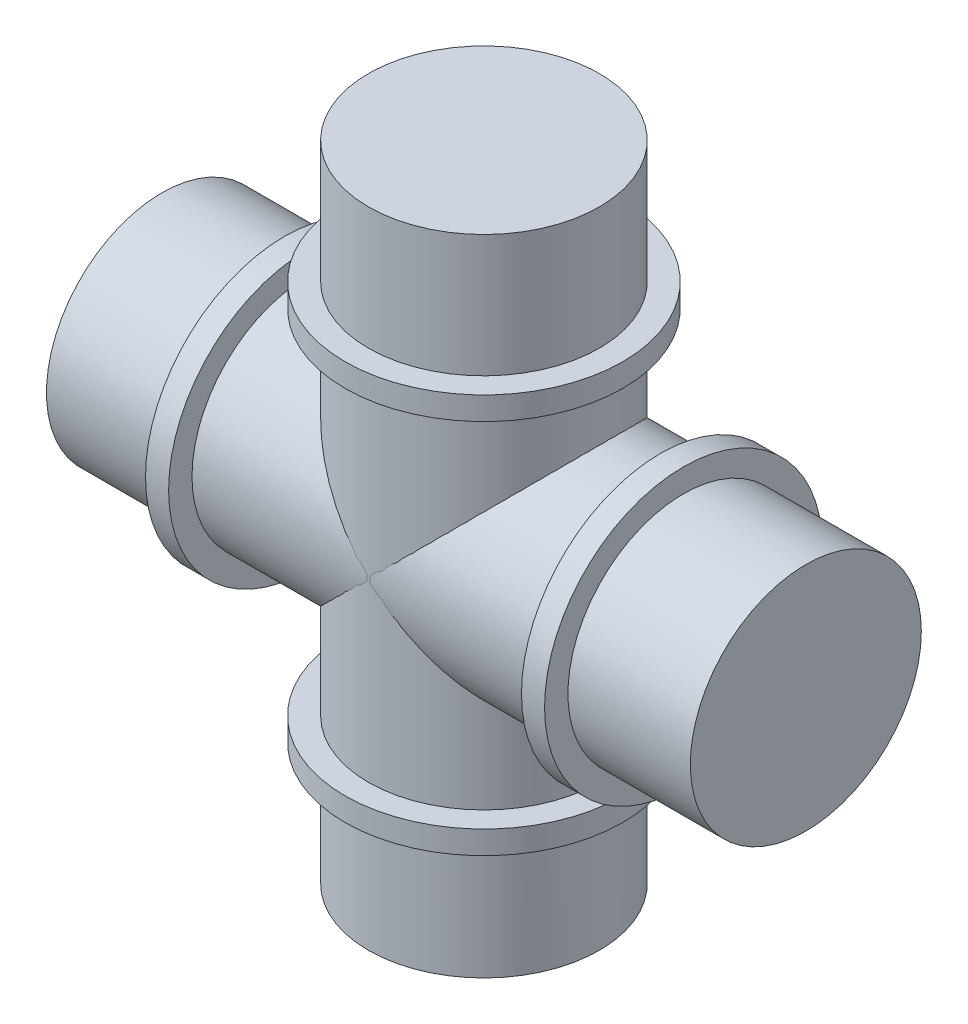
from build123d import *

# Parameters (mm, degrees)
BOSS_EXTRUDE1_DEPTH      = 304
BOSS_EXTRUDE1_DEPTH_BACK = 50
SKETCH1_R                = 63.5
BOSS_EXTRUDE2_DEPTH      = 177
BOSS_EXTRUDE2_DEPTH_BACK = 177
BOSS_EXTRUDE3_START      = -80
SKETCH5_R                = 76.35
SKETCH5_R_2              = 63.5
BOSS_EXTRUDE3_DEPTH      = 12.7
BOSS_EXTRUDE4_START      = -80
SKETCH6_R                = 76.35
BOSS_EXTRUDE4_DEPTH      = 12.7
BOSS_EXTRUDE5_START      = -80
SKETCH7_R                = 76.35
SKETCH7_R_2              = 63.5
BOSS_EXTRUDE5_DEPTH      = 12.7
BOSS_EXTRUDE6_START      = -67.3
SKETCH8_R                = 76.35
BOSS_EXTRUDE6_DEPTH      = 12.7


with BuildPart() as part:
    # Sketch1 → Boss-Extrude1 (new, two sides: drawn at the far end of the back side and taken through both)
    with BuildSketch(Plane(origin=(0, 0, 0), x_dir=(1, 0, 0), z_dir=(0, 1, 0)).offset(-BOSS_EXTRUDE1_DEPTH_BACK)):
        Circle(SKETCH1_R)
    extrude(amount=BOSS_EXTRUDE1_DEPTH + BOSS_EXTRUDE1_DEPTH_BACK)

    # Sketch6 → Boss-Extrude4 (add)
    with BuildSketch(Plane.XZ.offset(50).offset(BOSS_EXTRUDE4_START)):
        Circle(SKETCH6_R)
    extrude(amount=BOSS_EXTRUDE4_DEPTH)

    # Sketch8 → Boss-Extrude6 (add)
    with BuildSketch(Plane(origin=(0, 304, 0), x_dir=(1, 0, 0), z_dir=(0, 1, 0)).offset(BOSS_EXTRUDE6_START)):
        Circle(SKETCH8_R)
    extrude(amount=-BOSS_EXTRUDE6_DEPTH)


with BuildPart() as body_2:
    # Sketch3 → Boss-Extrude2 (new, two sides: drawn at the far end of the back side and taken through both)
    with BuildSketch(Plane(origin=(0, 0, 0), x_dir=(0, 0, -1), z_dir=(1, 0, 0)).offset(-BOSS_EXTRUDE2_DEPTH_BACK)):
        with BuildLine():
            ThreePointArc((0, 63.5), (44.901280605, 82.098719395), (63.5, 127))
            ThreePointArc((63.5, 127), (-44.901280605, 171.901280605), (0, 63.5))
        make_face()
    extrude(amount=BOSS_EXTRUDE2_DEPTH + BOSS_EXTRUDE2_DEPTH_BACK)

    # Sketch5 → Boss-Extrude3 (add)
    with BuildSketch(Plane(origin=(177, 0, 0), x_dir=(0, 0, -1), z_dir=(1, 0, 0)).offset(BOSS_EXTRUDE3_START)):
        with Locations((0, 127)):
            Circle(SKETCH5_R)
        with Locations((0, 127)):
            Circle(SKETCH5_R_2, mode=Mode.SUBTRACT)
    extrude(amount=BOSS_EXTRUDE3_DEPTH)

    # Sketch7 → Boss-Extrude5 (add)
    with BuildSketch(Plane.ZY.offset(177).offset(BOSS_EXTRUDE5_START)):
        with Locations((0, 127)):
            Circle(SKETCH7_R)
        with Locations((0, 127)):
            Circle(SKETCH7_R_2, mode=Mode.SUBTRACT)
    extrude(amount=BOSS_EXTRUDE5_DEPTH)


solid = Compound([part.part, body_2.part])
